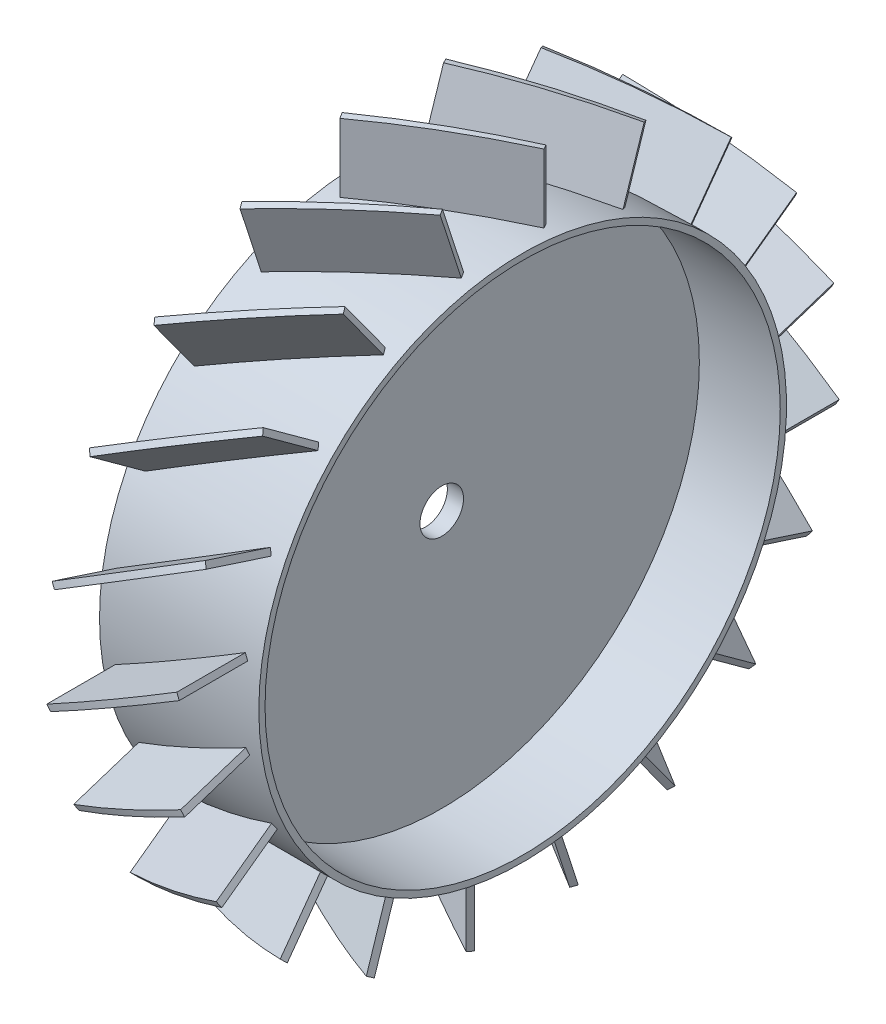
from build123d import *

# Parameters (mm, degrees)
BOSS_EXTRUDE1_REACH        = 165.116
BOSS_EXTRUDE1_START_RADIUS = 53.848
BOSS_EXTRUDE1_END_RADIUS   = 53.848
CIRPATTERN15_COUNT         = 20
SKETCH7_R                  = 4.445
CUT_EXTRUDE1_DEPTH         = 98.934047154


with BuildPart() as part:
    # Sketch1 → Revolve1 (revolve)
    with BuildSketch(Plane(origin=(0, 0, 0), x_dir=(1, 0, 0), z_dir=(0, 1, 0))):
        Polygon((3.302, 0), (3.302, 52.578), (19.812, 52.578), (19.812, 53.848), (-12.7, 53.848), (-12.7, 52.578), (0, 52.578), (0, 0), align=None)
    revolve(axis=Axis((0, 0, 0), (1, 0, 0)))

    # Boss-Extrude1: from a cylinder face, 165.116 long prism both ways, kept between that surface and its translate by the depth
    boss_extrude1_start = Plane(origin=(3.556, 0, 0), z_dir=(-1, 0, 0)) * Cylinder(BOSS_EXTRUDE1_START_RADIUS, 438.928, mode=Mode.PRIVATE)
    boss_extrude1_end = Plane(origin=(3.556, 0, 13.97), z_dir=(-1, 0, 0)) * Cylinder(BOSS_EXTRUDE1_END_RADIUS, 438.928, mode=Mode.PRIVATE)
    # Sketch2 → Boss-Extrude1 (add, from a surface)
    with BuildSketch(Plane.XY.offset(83.82), mode=Mode.PRIVATE) as boss_extrude1_sk1:
        Polygon((-9.324727154, -8.169926131), (17.071727154, 7.070073869), (16.436727154, 8.169926131), (-9.959727154, -7.070073869), align=None)
    boss_extrude1_tool1 = extrude(boss_extrude1_sk1.sketch, amount=BOSS_EXTRUDE1_REACH, both=True, mode=Mode.PRIVATE)
    boss_extrude1 = ((boss_extrude1_tool1 - boss_extrude1_start) & boss_extrude1_end).solids().sort_by_distance((-12.7, 0, 53.848))[0]
    add(boss_extrude1)

    # CirPattern15: Boss-Extrude1 ×20 about axis
    cirpattern15_axis = Axis((19.812, 0, 0), (-1, 0, 0))
    for i in range(1, CIRPATTERN15_COUNT):
        add(boss_extrude1.rotate(cirpattern15_axis, i * 360 / CIRPATTERN15_COUNT))

    # Sketch7 → Cut-Extrude1 (cut, through all)
    with BuildSketch(Plane.ZY):
        Circle(SKETCH7_R)
    extrude(amount=-CUT_EXTRUDE1_DEPTH, mode=Mode.SUBTRACT)


solid = part.part
